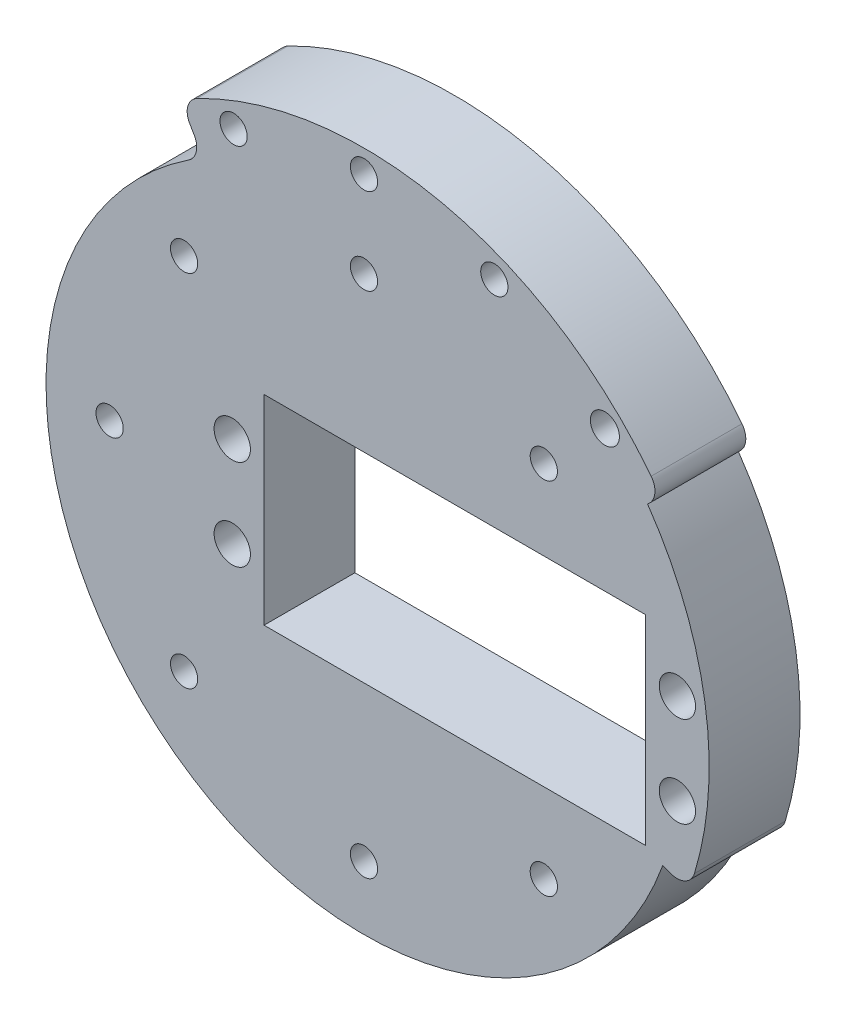
from build123d import *

# Parameters (mm, degrees)
SKETCH_2_R      = 1.5
SKETCH_2_R_2    = 2
SKETCH_2_W      = 42
SKETCH_2_H      = 22
SKETCH_2_R_3    = 1.6
EXTRUDE_2_DEPTH = 10
FILLET_1_R      = 2


with BuildPart() as part:
    # 草图2 → 凸台-拉伸2 (new body)
    with BuildSketch(Plane.XY):
        with BuildLine():
            ThreePointArc((35.709805767, -12.992681481), (37.684421913, 4.88716125), (31.214285714, 21.671833502))
            Line((31.214285714, 21.671833502), (32.857142857, 22.812456318))
            ThreePointArc((32.857142857, 22.812456318), (8.608258655, 39.062742901), (-20.224954765, 34.510160892))
            Line((-20.224954765, 34.510160892), (-17.696835419, 30.19639078))
            ThreePointArc((-17.696835419, 30.19639078), (-22.408690047, -26.885881246), (32.890610575, -11.96694347))
            Line((32.890610575, -11.96694347), (35.709805767, -12.992681481))
        make_face()
        with Locations((-19.798989873, -19.798989873)):
            Circle(SKETCH_2_R, mode=Mode.SUBTRACT)
        with Locations((0, -28)):
            Circle(SKETCH_2_R, mode=Mode.SUBTRACT)
        with Locations((-14.5, -5)):
            Circle(SKETCH_2_R_2, mode=Mode.SUBTRACT)
        with Locations((-28, 0)):
            Circle(SKETCH_2_R, mode=Mode.SUBTRACT)
        with Locations((19.798989873, -19.798989873)):
            Circle(SKETCH_2_R, mode=Mode.SUBTRACT)
        with Locations((10, 0)):
            Rectangle(SKETCH_2_W, SKETCH_2_H, mode=Mode.SUBTRACT)
        with Locations((34.5, -5)):
            Circle(SKETCH_2_R_2, mode=Mode.SUBTRACT)
        with Locations((-14.5, 5)):
            Circle(SKETCH_2_R_2, mode=Mode.SUBTRACT)
        with Locations((-19.798989873, 19.798989873)):
            Circle(SKETCH_2_R, mode=Mode.SUBTRACT)
        with Locations((0, 28)):
            Circle(SKETCH_2_R, mode=Mode.SUBTRACT)
        with Locations((19.798989873, 19.798989873)):
            Circle(SKETCH_2_R, mode=Mode.SUBTRACT)
        with Locations((34.5, 5)):
            Circle(SKETCH_2_R_2, mode=Mode.SUBTRACT)
        with Locations((26.516504294, 26.516504294)):
            Circle(SKETCH_2_R_3, mode=Mode.SUBTRACT)
        with Locations((14.350628714, 34.645482469)):
            Circle(SKETCH_2_R, mode=Mode.SUBTRACT)
        with Locations((0, 37.5)):
            Circle(SKETCH_2_R, mode=Mode.SUBTRACT)
        with Locations((-14.350628714, 34.645482469)):
            Circle(SKETCH_2_R, mode=Mode.SUBTRACT)
    extrude(amount=EXTRUDE_2_DEPTH)

    # 圆角1
    # the kernel refuses this fillet: 2 mm, written as the material it adds along each edge
    with BuildSketch(Plane(origin=(-17.696835419, 30.19639078, 0), x_dir=(-0.5056238691162223, 0.862754022291372, 0), z_dir=(0, 0, 1))) as fillet_1_piece_1:
        with BuildLine():
            CenterArc((1.945906404, 2), FILLET_1_R, 183.09857934, 86.90142066)
            ThreePointArc((-0.051169618, 1.891891892), (-0.012794743, 0.946291876), (0, 0))
            Line((0, 0), (1.945906404, 0))
        make_face()
    extrude(amount=10)
    # the kernel refuses this fillet: 2 mm, written as the material it takes off along each edge
    with BuildSketch(Plane(origin=(35.709805767, -12.992681481, -5.279816712), x_dir=(0.3156668887072375, 0.9488700729677867, 0), z_dir=(0, 0, 1))) as fillet_1_2_piece_1:
        with BuildLine():
            CenterArc((2.056349667, 1.99922765), FILLET_1_R, 178.407630732, 93.184738537)
            Line((0.057122017, 2.054804668), (0, 0))
            ThreePointArc((0, 0), (1.055963342, -0.014674657), (2.111926685, 0))
        make_face()
    extrude(amount=20.559633424, mode=Mode.SUBTRACT)
    with BuildSketch(Plane(origin=(32.857142857, 22.812456318, -5.26498253), x_dir=(-0.8214285714285717, -0.5703114079525466, 0), z_dir=(0, 0, 1))) as fillet_1_2_piece_2_section:
        with BuildLine():
            CenterArc((2.052668078, -2), FILLET_1_R, 90, 93.01696131)
            ThreePointArc((0.055440082, -2.105263158), (0.013862423, -1.052996506), (0, 0))
            Line((0, 0), (2.052668078, 0))
        make_face()
    fillet_1_2_piece_2 = extrude(amount=20.52996506, mode=Mode.PRIVATE)
    fillet_1_2_piece_2 = fillet_1_2_piece_2 - Plane(origin=(0, 0, 5), x_dir=(0.9397317307134324, -0.3419126705612664, 0), z_dir=(0, 0, -1)) * Cylinder(38, 50, mode=Mode.PRIVATE)
    add(fillet_1_2_piece_2, mode=Mode.SUBTRACT)
    with BuildSketch(Plane(origin=(-20.224954765, 34.510160892, -5.26498253), x_dir=(0.8757655299583756, 0.48273671554660663, 0), z_dir=(0, 0, 1))) as fillet_1_2_piece_3:
        with BuildLine():
            CenterArc((2.053343187, -1.999306879), FILLET_1_R, 88.491519345, 93.01696131)
            Line((0.054036308, -2.051956704), (0, 0))
            ThreePointArc((0, 0), (1.052996506, 0.013862423), (2.105993012, 0))
        make_face()
    extrude(amount=20.52996506, mode=Mode.SUBTRACT)


solid = part.part
